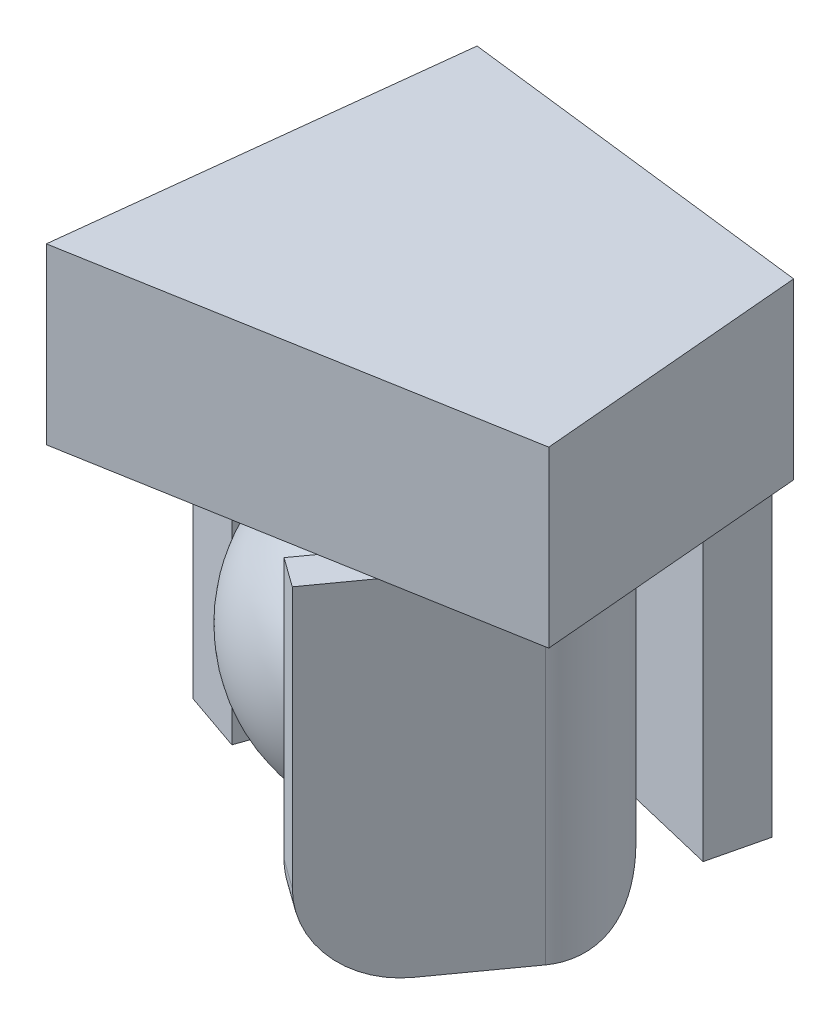
from build123d import *

# Parameters (mm, degrees)
BOSS_EXTRUDE1_START = -100
BOSS_EXTRUDE1_DEPTH = 200
BOSS_EXTRUDE2_START = 100
BOSS_EXTRUDE2_DEPTH = 100
FILLET4_R           = 50
FILLET5_R           = 50


with BuildPart() as part:
    # Sketch2 → Revolve1 (revolve)
    with BuildSketch(Plane.XY):
        with BuildLine():
            Line((0, 83.99866675223616), (0, -83.99866675223616))
            ThreePointArc((0, -83.99866675223616), (-83.99866675223616, 1.029e-14), (0, 83.99866675223616))
        make_face()
    revolve(axis=Axis((0, 83.99866675223616, 0), (0, -1, 0)))

    # Sketch3 → Cut-Revolve1 (revolve, cut)
    with BuildSketch(Plane.XY):
        with BuildLine():
            Line((0, 80.78753047196574), (0, -80.78753047196574))
            ThreePointArc((0, -80.78753047196574), (-80.78753047196574, 9.89e-15), (0, 80.78753047196574))
        make_face()
    revolve(axis=Axis((0, 80.78753047196574, 0), (0, -1, 0)), mode=Mode.SUBTRACT)

    # Sketch4 → Boss-Extrude1 (add)
    with BuildSketch(Plane(origin=(0, 0, 0), x_dir=(1, 0, 0), z_dir=(0, 1, 0)).offset(BOSS_EXTRUDE1_START)):
        Polygon((112.54766400764188, 11.102674962916051), (27.984824564062315, -106.46400649371546), (44.86622080796269, -118.60638205853901), (131.25655362126273, 1.5010410793763536), align=None)
        Polygon((-33.76429920229263, 94.6008743415586), (99.61989179054804, 62.66167239344396), (107.26781928097456, 94.6008743415586), (-30.8745618831775, 121.36896740283562), align=None)
        Polygon((-66.15977546395177, 65.39931827471092), (-93.84041715231778, -14.600778033423827), (-128.15679158223395, -2.7270515196505585), (-99.54190589937616, 79.97311259674068), align=None)
    extrude(amount=BOSS_EXTRUDE1_DEPTH)


with BuildPart() as boss_extrude1_piece_1:
    # of the separate pieces the step leaves, piece 1, a body of its own (boss_extrude1_pieces)
    add(part.part.solids().sort_by_distance((0, -83.998666752, 0))[0])



with BuildPart() as boss_extrude1_piece_2:
    # of the separate pieces the step leaves, piece 2, a body of its own (boss_extrude1_pieces)
    add(part.part.solids().sort_by_distance((-33.764299202, -100, -94.600874342))[0])


with BuildPart() as boss_extrude1_piece_3:
    # of the separate pieces the step leaves, piece 3, a body of its own (boss_extrude1_pieces)
    add(part.part.solids().sort_by_distance((112.547664008, -100, -11.102674963))[0])


with BuildPart() as boss_extrude1_piece_1_1:
    add(boss_extrude1_piece_1.part)

    add(boss_extrude1_piece_2.part)  # Boss-Extrude2 merges Boss-Extrude1 piece 2

    add(boss_extrude1_piece_3.part)  # Boss-Extrude2 merges Boss-Extrude1 piece 3
    # Sketch4<3> → Boss-Extrude2 (add)
    with BuildSketch(Plane(origin=(0, 0, 0), x_dir=(1, 0, 0), z_dir=(0, 1, 0)).offset(BOSS_EXTRUDE2_START)):
        Polygon((-71.1192338079553, 103.5456135287754), (-96.42597159573657, -118.60638205853901), (149.04960909120163, -75.4373531726898), (135.6655625605631, 78.63127336750127), align=None)
    extrude(amount=BOSS_EXTRUDE2_DEPTH)

    # Fillet4
    # the kernel refuses this fillet: 50 mm, written as the material it takes off along each edge
    with BuildSketch(Plane(origin=(-73.49181604435654, -100, 33.47434002763414), x_dir=(2e-16, 1, -2.8e-16), z_dir=(0.8118131248673509, 0, 0.5839173317286507))) as fillet4_piece_1:
        with BuildLine():
            CenterArc((FILLET4_R, -FILLET4_R), FILLET4_R, 90.00000000000003, 89.99999999999997)
            Line((1.73e-14, -FILLET4_R), (-FILLET4_R * 0.02, -FILLET4_R))
            Line((-FILLET4_R * 0.02, -FILLET4_R), (-FILLET4_R * 0.02, FILLET4_R * 0.02))
            Line((-FILLET4_R * 0.02, FILLET4_R * 0.02), (FILLET4_R, FILLET4_R * 0.02))
            Line((FILLET4_R, FILLET4_R * 0.02), (FILLET4_R, 0))
        make_face()
    extrude(amount=270.79468257754365, mode=Mode.SUBTRACT)
    with BuildSketch(Plane(origin=(171.7917074692354, -100, -93.46894402013166), x_dir=(0, 1, 0), z_dir=(-0.5839173317286501, 0, 0.8118131248673512))) as fillet4_piece_2:
        with BuildLine():
            CenterArc((40.583856818365355, -50), FILLET4_R, 90, 54.26011731322143)
            Line((0, -20.794682577543853), (-0.8116771363673081, -20.21057622909473))
            ThreePointArc((-0.8116771363673081, -20.21057622909473), (-1, -10.397341288771914), (-1, -6.48e-15))
            Line((-1, -6.48e-15), (0, 1.0000000000000047))
            Line((0, 1.0000000000000047), (40.583856818365355, 0.9999999999999881))
            Line((40.583856818365355, 0.9999999999999881), (40.583856818365355, 0))
        make_face()
    extrude(amount=347.739166716712, mode=Mode.SUBTRACT)

    # Fillet5
    # the kernel refuses this fillet: 50 mm, written as the material it takes off along each edge
    with BuildSketch(Plane(origin=(131.25655362126273, -209.28392328582004, -1.50104107937635), x_dir=(-0.8896758585741418, 0, -0.4565926704080605), z_dir=(0, 1, 0))) as fillet5_piece_1:
        with BuildLine():
            CenterArc((55.94900253333829, 35.785265930590285), FILLET5_R, 171.4409151223373, 54.26011731322126)
            Line((6.5058569003557185, 43.22672747491594), (5.516993987696065, 43.37555670580245))
            Line((5.516993987696065, 43.37555670580245), (-0.9888629126596437, 0.1488292308865173))
            Line((-0.9888629126596437, 0.1488292308865173), (-9.07e-15, -1.0000000000000053))
            ThreePointArc((-9.07e-15, -1.0000000000000053), (10.514441542566455, -0.9999999999999917), (20.330480696168753, -0.7157053186118065))
            Line((20.330480696168753, -0.7157053186118065), (21.02888308513286, 9.6e-16))
        make_face()
    extrude(amount=309.28392328582004, mode=Mode.SUBTRACT)


solid = boss_extrude1_piece_1_1.part
